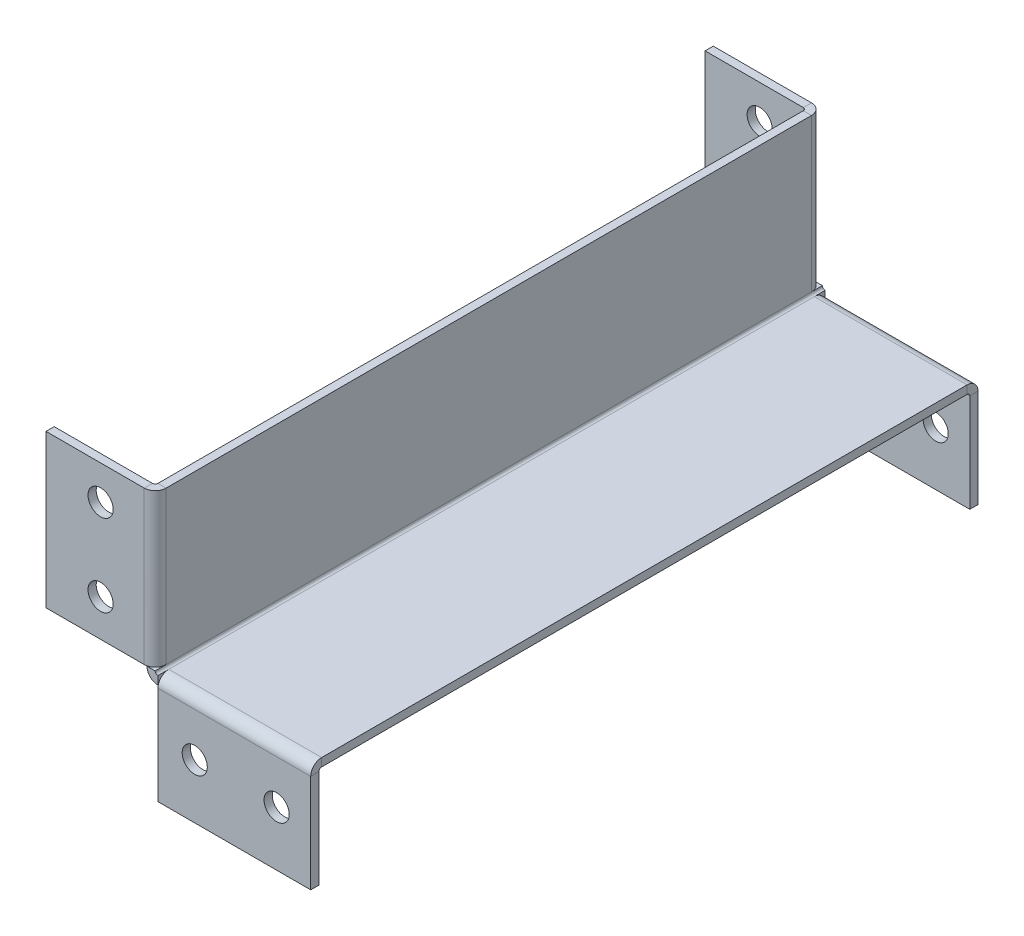
from build123d import *

# Parameters (mm, degrees)
SKETCH1_W                      = 60
SKETCH1_H                      = 244.5
BASE_FLANGE1_DEPTH             = 3
EDGE_FLANGE1_STRIP_W           = 14
EDGE_FLANGE1_STRIP_H           = 3
EDGE_FLANGE1_STRIP_CUT_DEPTH   = 244.5
EDGE_FLANGE1_DEPTH             = 244.5
EDGE_FLANGE2_STRIP_W           = 14
EDGE_FLANGE2_STRIP_H           = 3
EDGE_FLANGE2_STRIP_CUT_DEPTH   = 56
EDGE_FLANGE2_STRIP_2_W         = 14
EDGE_FLANGE2_STRIP_2_H         = 3
EDGE_FLANGE2_STRIP_CUT_2_DEPTH = 56
EDGE_FLANGE2_STRIP_3_W         = 14
EDGE_FLANGE2_STRIP_3_H         = 3
EDGE_FLANGE2_STRIP_CUT_3_DEPTH = 56
EDGE_FLANGE2_STRIP_4_W         = 14
EDGE_FLANGE2_STRIP_4_H         = 3
EDGE_FLANGE2_STRIP_CUT_4_DEPTH = 56
EDGE_FLANGE2_DEPTH             = 56
EDGE_FLANGE2_BEND_DEPTH        = 56
EDGE_FLANGE2_BEND_2_DEPTH      = 56
EDGE_FLANGE2_BEND_3_DEPTH      = 56
SKETCH18_R                     = 4.6
EXTRUDE1_DEPTH                 = 261.517273899


# Sheet-metal steps are written as plain solids
with BuildPart() as part:
    # Sketch1 → Base-Flange1 (new body)
    with BuildSketch(Plane(origin=(0, 0, 0), x_dir=(1, 0, 0), z_dir=(0, 1, 0))):
        Rectangle(SKETCH1_W, SKETCH1_H)
    extrude(amount=BASE_FLANGE1_DEPTH)

    # Edge-Flange1 strip (across the edge) → Edge-Flange1 strip cut (cut)
    with BuildSketch(Plane(origin=(-30, 3, -122.25), x_dir=(1, 0, 0), z_dir=(0, 0, 1))):
        with Locations((-3, -1.5)):
            Rectangle(EDGE_FLANGE1_STRIP_W, EDGE_FLANGE1_STRIP_H)
    extrude(amount=EDGE_FLANGE1_STRIP_CUT_DEPTH, mode=Mode.SUBTRACT)

    # Edge-Flange1 section (across the edge) → Edge-Flange1 (add)
    with BuildSketch(Plane(origin=(-30, 3, -122.25), x_dir=(1, 0, 0), z_dir=(0, 0, 1))):
        with BuildLine():
            Line((0, 1), (0, 57))
            Line((0, 57), (3, 57))
            Line((3, 57), (3, 1))
            ThreePointArc((3, 1), (3.292893219, 0.292893219), (4, 0))
            Line((4, 0), (4, -3))
            ThreePointArc((4, -3), (1.171572875, -1.828427125), (0, 1))
        make_face()
    extrude(amount=EDGE_FLANGE1_DEPTH)

    # Edge-Flange2 strip (across the edge) → Edge-Flange2 strip cut (cut)
    with BuildSketch(Plane(origin=(-30, 4, 122.25), x_dir=(0, 0, -1), z_dir=(0, 1, 0))):
        with Locations((-3, -1.5)):
            Rectangle(EDGE_FLANGE2_STRIP_W, EDGE_FLANGE2_STRIP_H)
    extrude(amount=EDGE_FLANGE2_STRIP_CUT_DEPTH, mode=Mode.SUBTRACT)

    # Edge-Flange2 strip 2 (across the edge) → Edge-Flange2 strip cut 2 (cut)
    with BuildSketch(Plane(origin=(30, 0, 122.25), x_dir=(0, 0, -1), z_dir=(-1, 0, 0))):
        with Locations((-3, -1.5)):
            Rectangle(EDGE_FLANGE2_STRIP_2_W, EDGE_FLANGE2_STRIP_2_H)
    extrude(amount=EDGE_FLANGE2_STRIP_CUT_2_DEPTH, mode=Mode.SUBTRACT)

    # Edge-Flange2 strip 3 (across the edge) → Edge-Flange2 strip cut 3 (cut)
    with BuildSketch(Plane(origin=(-30, 60, -122.25), x_dir=(0, 0, 1), z_dir=(0, -1, 0))):
        with Locations((-3, -1.5)):
            Rectangle(EDGE_FLANGE2_STRIP_3_W, EDGE_FLANGE2_STRIP_3_H)
    extrude(amount=EDGE_FLANGE2_STRIP_CUT_3_DEPTH, mode=Mode.SUBTRACT)

    # Edge-Flange2 strip 4 (across the edge) → Edge-Flange2 strip cut 4 (cut)
    with BuildSketch(Plane(origin=(-26, 0, -122.25), x_dir=(0, 0, 1), z_dir=(1, 0, 0))):
        with Locations((-3, -1.5)):
            Rectangle(EDGE_FLANGE2_STRIP_4_W, EDGE_FLANGE2_STRIP_4_H)
    extrude(amount=EDGE_FLANGE2_STRIP_CUT_4_DEPTH, mode=Mode.SUBTRACT)

    # Edge-Flange2 section (across the edge) → Edge-Flange2 (add)
    with BuildSketch(Plane(origin=(-30, 4, 122.25), x_dir=(0, 0, -1), z_dir=(0, 1, 0))):
        with BuildLine():
            Line((0, 1), (0, 37))
            Line((0, 37), (3, 37))
            Line((3, 37), (3, 1))
            ThreePointArc((3, 1), (3.292893219, 0.292893219), (4, 0))
            Line((4, 0), (4, -3))
            ThreePointArc((4, -3), (1.171572875, -1.828427125), (0, 1))
        make_face()
    extrude(amount=EDGE_FLANGE2_DEPTH)

    # Edge-Flange2 section 2 (across the edge) → Edge-Flange2 bend (add)
    with BuildSketch(Plane(origin=(30, 0, 122.25), x_dir=(0, 0, -1), z_dir=(-1, 0, 0))):
        with BuildLine():
            Line((0, 1), (0, 37))
            Line((0, 37), (3, 37))
            Line((3, 37), (3, 1))
            ThreePointArc((3, 1), (3.292893219, 0.292893219), (4, 0))
            Line((4, 0), (4, -3))
            ThreePointArc((4, -3), (1.171572875, -1.828427125), (0, 1))
        make_face()
    extrude(amount=EDGE_FLANGE2_BEND_DEPTH)

    # Edge-Flange2 section 3 (across the edge) → Edge-Flange2 bend 2 (add)
    with BuildSketch(Plane(origin=(-30, 60, -122.25), x_dir=(0, 0, 1), z_dir=(0, -1, 0))):
        with BuildLine():
            Line((0, 1), (0, 37))
            Line((0, 37), (3, 37))
            Line((3, 37), (3, 1))
            ThreePointArc((3, 1), (3.292893219, 0.292893219), (4, 0))
            Line((4, 0), (4, -3))
            ThreePointArc((4, -3), (1.171572875, -1.828427125), (0, 1))
        make_face()
    extrude(amount=EDGE_FLANGE2_BEND_2_DEPTH)

    # Edge-Flange2 section 4 (across the edge) → Edge-Flange2 bend 3 (add)
    with BuildSketch(Plane(origin=(-26, 0, -122.25), x_dir=(0, 0, 1), z_dir=(1, 0, 0))):
        with BuildLine():
            Line((0, 1), (0, 37))
            Line((0, 37), (3, 37))
            Line((3, 37), (3, 1))
            ThreePointArc((3, 1), (3.292893219, 0.292893219), (4, 0))
            Line((4, 0), (4, -3))
            ThreePointArc((4, -3), (1.171572875, -1.828427125), (0, 1))
        make_face()
    extrude(amount=EDGE_FLANGE2_BEND_3_DEPTH)

    # Sketch18 → Extrude1 (cut, through all)
    with BuildSketch(Plane.XY.offset(122.25)):
        with Locations((-47, 47.5)):
            Circle(SKETCH18_R)
        with Locations((-47, 17.5)):
            Circle(SKETCH18_R)
        with Locations((-12.5, -17)):
            Circle(SKETCH18_R)
        with Locations((17.5, -17)):
            Circle(SKETCH18_R)
    extrude(amount=-EXTRUDE1_DEPTH, mode=Mode.SUBTRACT)


solid = part.part
